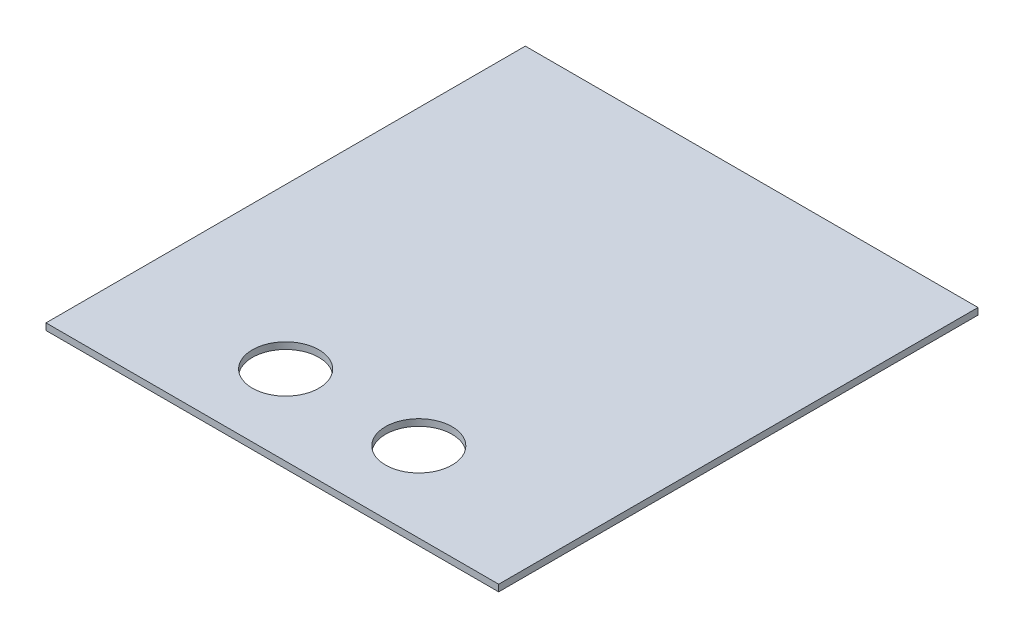
from build123d import *

# Parameters (mm, degrees)
SKETCH1_W           = 215.9
SKETCH1_H           = 228.6
BOSS_EXTRUDE1_DEPTH = 3.175
SKETCH2_R           = 15.875
CUT_EXTRUDE1_DEPTH  = 315.453256661


with BuildPart() as part:
    # Sketch1 → Boss-Extrude1 (new body)
    with BuildSketch(Plane(origin=(0, 0, 0), x_dir=(1, 0, 0), z_dir=(0, 1, 0))):
        with Locations((107.95, 114.3)):
            Rectangle(SKETCH1_W, SKETCH1_H)
    extrude(amount=BOSS_EXTRUDE1_DEPTH)

    # Sketch2 → Cut-Extrude1 (cut, through all)
    with BuildSketch(Plane(origin=(0, 3.175, 0), x_dir=(1, 0, 0), z_dir=(0, 1, 0))):
        with Locations((139.7, 38.1)):
            Circle(SKETCH2_R)
        with Locations((76.2, 38.1)):
            Circle(SKETCH2_R)
    extrude(amount=-CUT_EXTRUDE1_DEPTH, mode=Mode.SUBTRACT)


solid = part.part
